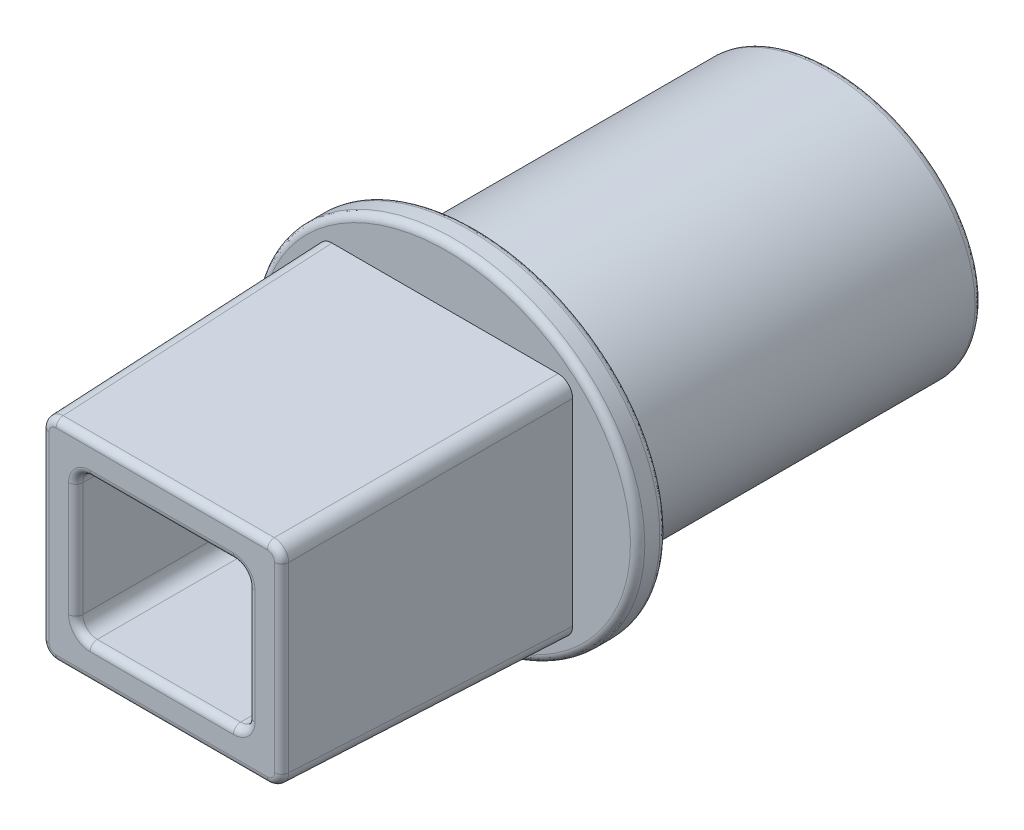
from build123d import *

# Parameters (mm, degrees)
SKETCH1_W           = 8.4709
SKETCH1_H           = 7.4422
BOSS_EXTRUDE1_DEPTH = 10.0203
BOSS_EXTRUDE1_DRAFT = 1.56
SKETCH2_W           = 6.0833
SKETCH2_H           = 5.0546
CUT_EXTRUDE1_DEPTH  = 10.0203
SKETCH3_RX          = 6.8072
SKETCH3_RY          = 6.0325
BOSS_EXTRUDE2_DEPTH = 1.0414
SKETCH4_W           = 3.5433
SKETCH4_H           = 2.5146
CUT_EXTRUDE2_DEPTH  = 1.0414
BOSS_EXTRUDE3_DEPTH = 12.7
FILLET1_R           = 0.508
FILLET2_R           = 0.254


# Read off the part's stored shape, not the designer's step: Boss-Extrude3
with BuildPart() as part:
    # Sketch1 → Boss-Extrude1 (with draft: the straight prism first)
    with BuildSketch(Plane.XY):
        with Locations((4.23545, 3.7211)):
            Rectangle(SKETCH1_W, SKETCH1_H)
    extrude(amount=-BOSS_EXTRUDE1_DEPTH)
    # Boss-Extrude1: the draft: its side faces are tilted about the plane it starts from
    boss_extrude1_sides = [part.faces().sort_by_distance(p)[0] for p in [
        (4.23545, 0, -5.01015),
        (8.4709, 3.7211, -5.01015),
        (4.23545, 7.4422, -5.01015),
        (0, 3.7211, -5.01015),
    ]]
    draft(boss_extrude1_sides, Plane.XY, BOSS_EXTRUDE1_DRAFT)

    # Sketch2 → Cut-Extrude1 (cut)
    with BuildSketch(Plane.XY):
        with Locations((4.23545, 3.7211)):
            Rectangle(SKETCH2_W, SKETCH2_H)
    extrude(amount=-CUT_EXTRUDE1_DEPTH, mode=Mode.SUBTRACT)

    # Sketch3 → Boss-Extrude2 (add)
    with BuildSketch(Plane(origin=(0, 0, -10.0203), x_dir=(-1, 0, 0), z_dir=(0, 0, -1))):
        with Locations(Location((-4.23545, 3.7211), (0, 0, 178.123459116))):
            Ellipse(SKETCH3_RX, SKETCH3_RY)
    extrude(amount=BOSS_EXTRUDE2_DEPTH)

    # Sketch4 → Cut-Extrude2 (cut)
    with BuildSketch(Plane.XY.offset(-10.0203)):
        with Locations((4.23545, 3.7211)):
            Rectangle(SKETCH4_W, SKETCH4_H)
    extrude(amount=-CUT_EXTRUDE2_DEPTH, mode=Mode.SUBTRACT)

    # Boss-Extrude3 outline → Boss-Extrude3 (add)
    with BuildSketch(Plane(origin=(0, 0, -11.0617), x_dir=(-1, 0, 0), z_dir=(0, 0, -1))):
        with BuildLine():
            add(Edge.make_bspline(
                [(-9.4869, 3.7211), (-9.4869, -4.153842202), (-1.609725, -0.216371101), (6.26745, 3.7211), (-1.609725, 7.658571101), (-9.4869, 11.596042202), (-9.4869, 3.7211)],
                knots=[0, 0, 0, 2.094395102, 2.094395102, 4.188790205, 4.188790205, 6.283185307, 6.283185307, 6.283185307], degree=2, weights=[1, 0.5, 1, 0.5, 1, 0.5, 1]))
        make_face()
        with BuildLine():
            add(Edge.make_bspline(
                [(-8.2931, 3.7211), (-8.2931, 3.305999836), (-8.105742217, 2.475799509), (-7.251809241, 1.354160514), (-5.891342595, 0.559793928), (-4.23545, 0.272553036), (-2.579557405, 0.559793928), (-1.219090759, 1.354160514), (-0.365157783, 2.475799509), (-0.084121109, 3.7211), (-0.365157783, 4.966400491), (-1.219090759, 6.088039486), (-2.579557405, 6.882406072), (-4.23545, 7.169646964), (-5.891342595, 6.882406072), (-7.251809241, 6.088039486), (-8.105742217, 4.966400491), (-8.2931, 4.136200164), (-8.2931, 3.7211)],
                knots=[0, 0, 0, 0, 0.392699082, 0.785398163, 1.178097245, 1.570796327, 1.963495408, 2.35619449, 2.748893572, 3.141592654, 3.534291735, 3.926990817, 4.319689899, 4.71238898, 5.105088062, 5.497787144, 5.890486225, 6.283185307, 6.283185307, 6.283185307, 6.283185307], degree=3))
        make_face(mode=Mode.SUBTRACT)
    extrude(amount=BOSS_EXTRUDE3_DEPTH)

    # Fillet1
    fillet1_edges = [part.edges().sort_by_distance(p)[0] for p in [
        (1.1938, 1.1938, -5.01015),
        (1.1938, 6.2484, -5.01015),
        (7.2771, 6.2484, -5.01015),
        (7.2771, 1.1938, -5.01015),
        (-0.136445755, 7.578645755, -5.01015),
        (8.607345755, 7.578645755, -5.01015),
        (8.607345755, -0.136445755, -5.01015),
        (-0.136445755, -0.136445755, -5.01015),
    ]]
    fillet(fillet1_edges, radius=FILLET1_R)

    # Fillet2
    fillet2_edges = [part.edges().sort_by_distance(p)[0] for p in [
        (-2.568104049, 3.498335242, -10.0203),
        (0, 3.7211, 0),
        (0.148711786, 7.293488214, 0),
        (0.148711786, 0.148711786, 0),
        (4.23545, 7.4422, 0),
        (4.23545, 0, 0),
        (8.322188214, 7.293488214, 0),
        (8.322188214, 0.148711786, 0),
        (8.4709, 3.7211, 0),
        (-2.568104049, 3.498335242, -11.0617),
        (4.23545, 1.1938, 0),
        (1.342589755, 1.342589755, 0),
        (7.128310245, 1.342589755, 0),
        (1.1938, 3.7211, 0),
        (7.2771, 3.7211, 0),
        (1.342589755, 6.099610245, 0),
        (7.128310245, 6.099610245, 0),
        (4.23545, 6.2484, 0),
        (-1.016, 3.7211, -23.7617),
        (0.1778, 3.7211, -23.7617),
    ]]
    fillet(fillet2_edges, radius=FILLET2_R)


solid = part.part
